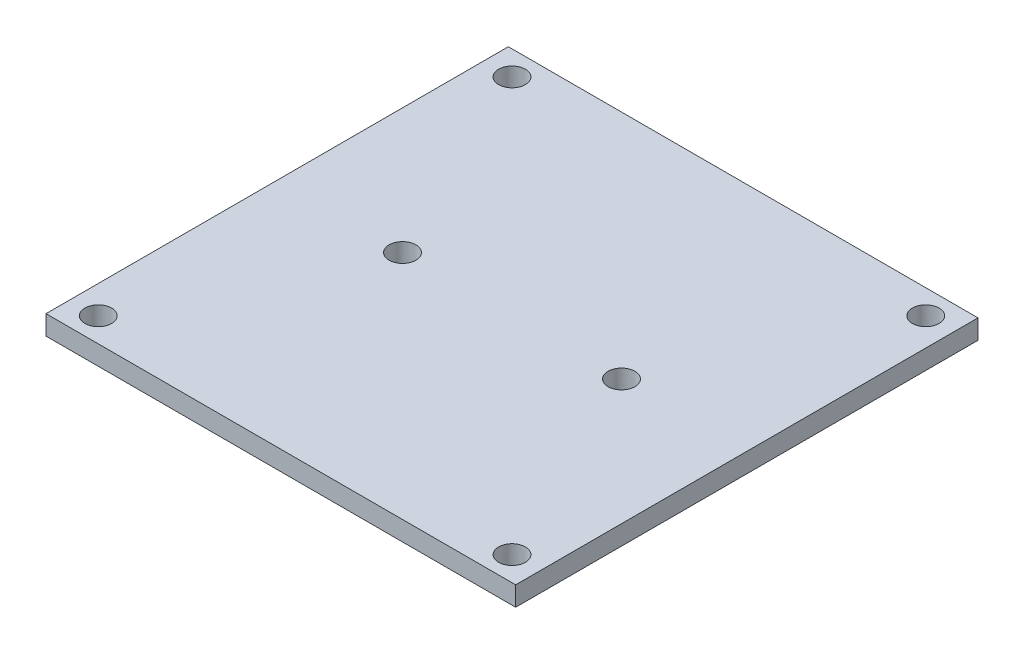
from build123d import *

# Parameters (mm, degrees)
SKETCH1_W               = 38.6
SKETCH1_H               = 38
SKETCH1_R               = 1.1
CAMERA_BOARD_BASE_DEPTH = 1.6
SKETCH1_5_W             = 7
SKETCH1_5_H             = 7
SENSOR_DEPTH            = 2.6


with BuildPart() as part:
    # Sketch1 → Camera Board Base (new body)
    with BuildSketch(Plane(origin=(0, 0, 0), x_dir=(1, 0, 0), z_dir=(0, 1, 0))):
        Rectangle(SKETCH1_W, SKETCH1_H)
        with Locations((-17, -17)):
            Circle(SKETCH1_R, mode=Mode.SUBTRACT)
        with Locations((17, -17)):
            Circle(SKETCH1_R, mode=Mode.SUBTRACT)
        with Locations((-9, 0)):
            Circle(SKETCH1_R, mode=Mode.SUBTRACT)
        with Locations((-17, 17)):
            Circle(SKETCH1_R, mode=Mode.SUBTRACT)
        with Locations((9, 0)):
            Circle(SKETCH1_R, mode=Mode.SUBTRACT)
        with Locations((17, 17)):
            Circle(SKETCH1_R, mode=Mode.SUBTRACT)
    extrude(amount=-CAMERA_BOARD_BASE_DEPTH)

    # Sketch1<5> → Sensor (add)
    with BuildSketch(Plane(origin=(0, 0, 0), x_dir=(1, 0, 0), z_dir=(0, 1, 0))):
        Rectangle(SKETCH1_5_W, SKETCH1_5_H)
    extrude(amount=-SENSOR_DEPTH)


solid = part.part
